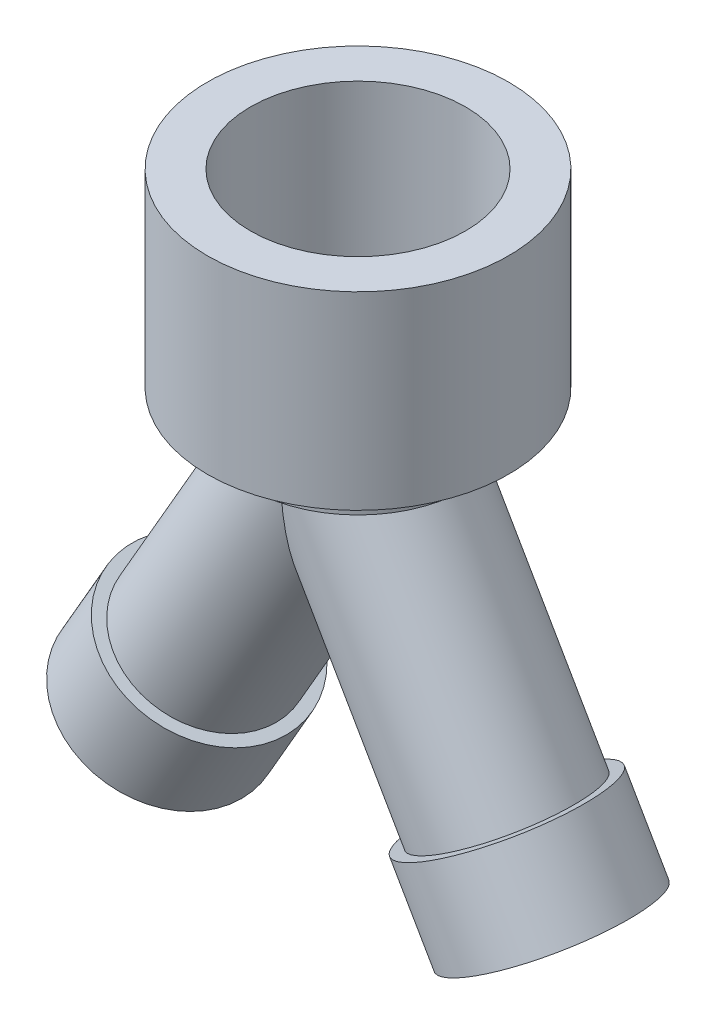
from build123d import *

# Parameters (mm, degrees)
SKETCH1_R           = 22.225
SKETCH1_R_2         = 15.875
BOSS_EXTRUDE1_DEPTH = 25.4
BOSS_EXTRUDE2_START = 2.54
SKETCH2_R           = 22.225
BOSS_EXTRUDE2_DEPTH = 2.54
BOSS_EXTRUDE3_START = 5.08
SKETCH3_R           = 15.875
BOSS_EXTRUDE3_DEPTH = 5.08
BOSS_EXTRUDE4_START = -13.208
SKETCH5_R           = 13.15140871
SKETCH5_R_2         = 11.43
BOSS_EXTRUDE4_DEPTH = 13.208


with BuildPart() as part:
    # Sketch1 → Boss-Extrude1 (new body)
    with BuildSketch(Plane(origin=(0, 0, 0), x_dir=(1, 0, 0), z_dir=(0, 1, 0))):
        Circle(SKETCH1_R)
        Circle(SKETCH1_R_2, mode=Mode.SUBTRACT)
    extrude(amount=BOSS_EXTRUDE1_DEPTH)

    # Sketch2 → Boss-Extrude2 (add)
    with BuildSketch(Plane.XZ.offset(BOSS_EXTRUDE2_START)):
        Circle(SKETCH2_R)
    extrude(amount=-BOSS_EXTRUDE2_DEPTH)

    # Sketch3 → Boss-Extrude3 (add)
    with BuildSketch(Plane.XZ.offset(2.54).offset(BOSS_EXTRUDE3_START)):
        Circle(SKETCH3_R)
    extrude(amount=-BOSS_EXTRUDE3_DEPTH)

    # Sketch4 → Revolve1 (revolve)
    with BuildSketch(Plane.XY):
        Polygon((-38.473670365, -51.398351826), (-9.898670365, -1.905), (-6.599113577, -3.81), (-35.174113577, -53.303351826), align=None)
    revolve1 = revolve(axis=Axis((0, -7.62, 0), (-0.500000000000001, -0.8660254037844382, 0)))

    # Sketch5 → Boss-Extrude4 (add)
    with BuildSketch(Plane(origin=(-31.874556788, -55.208351826, 0), x_dir=(0.866025403784438, -0.5000000000000012, 0), z_dir=(-0.5000000000000011, -0.8660254037844379, 0)).offset(BOSS_EXTRUDE4_START)):
        with Locations((3.81, 0)):
            Circle(SKETCH5_R)
        with Locations((3.81, 0)):
            Circle(SKETCH5_R_2, mode=Mode.SUBTRACT)
    boss_extrude4 = extrude(amount=BOSS_EXTRUDE4_DEPTH)

    # Mirror1: Revolve1, Boss-Extrude4 across plane
    add(revolve1.mirror(Plane(origin=(0, 0, 0), x_dir=(0, 0, 1), z_dir=(1, 0, 0))))
    add(boss_extrude4.mirror(Plane(origin=(0, 0, 0), x_dir=(0, 0, 1), z_dir=(1, 0, 0))))


solid = part.part
